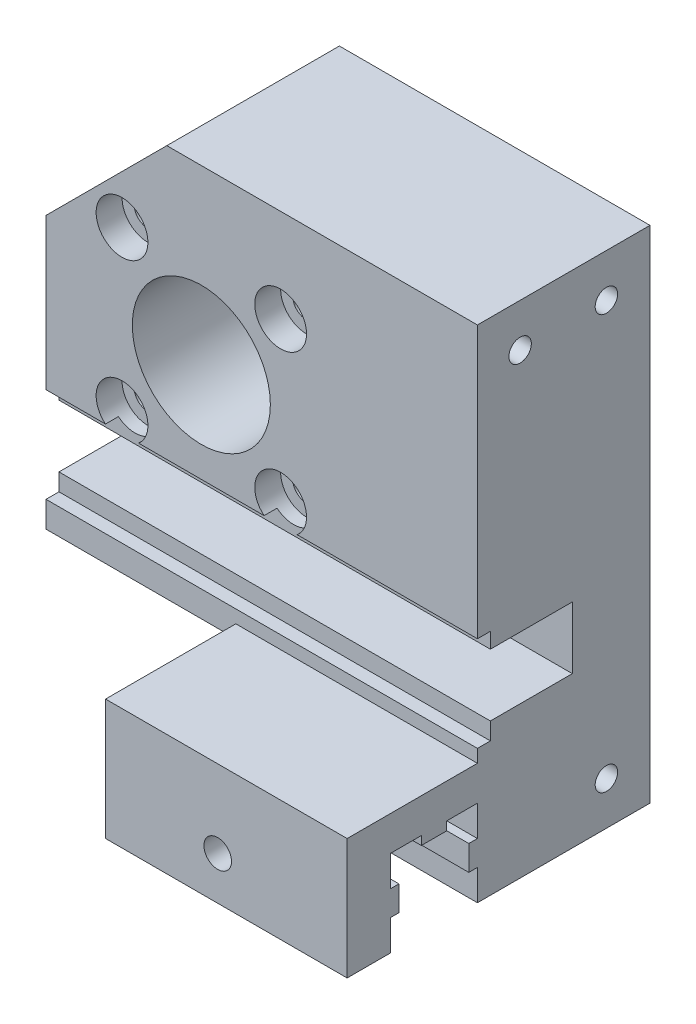
from build123d import *

# Parameters (mm, degrees)
ESQUISSE1_W                     = 50
ESQUISSE1_H                     = 45
MAIN_EXTRUSION_DEPTH            = 20
ESQUISSE5_R                     = 8
GEAR_LINEAR_HOLES_DEPTH         = 40.131189606
FIXING_EXTRUSION_DEPTH          = 25
ESQUISSE13_W                    = 50
ESQUISSE13_H                    = 7.2
ROLLINGBALLHORIZONTALHOLE_DEPTH = 11
FRONTHOLE_DEPTH                 = 22
ESQUISSE15_R                    = 1.6
BOTTOMFIXINGHOLE_DEPTH          = 56.832427853
ESQUISSE12_R                    = 16
REDUCTORMAINHOLE_DEPTH          = 5
REDUCTORFRONTFIXINGHOLE_DEPTH   = 3
ESQUISSE17_R                    = 1.6
MOTORFIXINGHOLE_DEPTH           = 53.832376437
ESQUISSE19_R                    = 3
ENL_V_MAT_EXTRU_5_DEPTH         = 3
SKETCH2_W                       = 1.5
SKETCH2_H                       = 11
CUTFORMAKERBEAMPROFILE_DEPTH    = 71.655926857
CUTFORDISTRIBUTORGRABBER_DEPTH  = 48.804288511
SKETCH4_R                       = 1.3
HOLETOBLOCKBEHIND_DEPTH         = 12


with BuildPart() as part:
    # Esquisse1 → Main Extrusion (new body)
    with BuildSketch(Plane.XY):
        Rectangle(ESQUISSE1_W, ESQUISSE1_H)
    extrude(amount=MAIN_EXTRUSION_DEPTH)

    # Esquisse5 → Gear Linear Holes (cut, through all)
    with BuildSketch(Plane.XY.offset(20)):
        with Locations((-7, 2.5)):
            Circle(ESQUISSE5_R)
    extrude(amount=-GEAR_LINEAR_HOLES_DEPTH, mode=Mode.SUBTRACT)

    # Esquisse8 → Fixing Extrusion (add, symmetric)
    with BuildSketch(Plane(origin=(0, 0, 0), x_dir=(0, 0, -1), z_dir=(1, 0, 0))):
        Polygon((-20, -25.5), (-20, -29.05), (-21, -29.05), (-21, -31.95), (-20, -31.95), (-20, -35.5), (0, -35.5), (0, -21.5), (-35.1, -21.5), (-35.1, -35.5), (-30.1, -35.5), (-30.1, -31.95), (-29.1, -31.95), (-29.1, -29.05), (-30.1, -29.05), (-30.1, -25.5), (-26.5, -25.5), (-26.5, -26.5), (-23.6, -26.5), (-23.6, -25.5), align=None)
    extrude(amount=FIXING_EXTRUSION_DEPTH, both=True)

    # Esquisse13 → RollingBallHorizontalHole (cut)
    with BuildSketch(Plane.XY.offset(20)):
        with Locations((0, -14.4)):
            Rectangle(ESQUISSE13_W, ESQUISSE13_H)
    extrude(amount=-ROLLINGBALLHORIZONTALHOLE_DEPTH, mode=Mode.SUBTRACT)

    # Esquisse14 → FrontHole (cut)
    with BuildSketch(Plane.ZY.offset(25)):
        Polygon((0, -23), (20, -23), (20, -18), (35.1, -18), (35.1, -35.5), (0, -35.5), align=None)
    extrude(amount=-FRONTHOLE_DEPTH, mode=Mode.SUBTRACT)

    # Esquisse15 → BottomFixingHole (cut, through all)
    with BuildSketch(Plane.XY.offset(35.1)):
        with Locations((10, -30.5)):
            Circle(ESQUISSE15_R)
    extrude(amount=-BOTTOMFIXINGHOLE_DEPTH, mode=Mode.SUBTRACT)

    # Esquisse12 → ReductorMainHole (cut)
    with BuildSketch(Plane.XY):
        with Locations((-7, 2.5)):
            Circle(ESQUISSE12_R)
    extrude(amount=REDUCTORMAINHOLE_DEPTH, mode=Mode.SUBTRACT)

    # Esquisse16 → ReductorFrontFixingHole (cut)
    with BuildSketch(Plane(origin=(0, 0, 5), x_dir=(-1, 0, 0), z_dir=(0, 0, -1))):
        with BuildLine():
            Line((2.641101056, 11.5), (11.358898944, 11.5))
            ThreePointArc((11.358898944, 11.5), (17, 2.5), (11.358898944, -6.5))
            Line((11.358898944, -6.5), (2.641101056, -6.5))
            ThreePointArc((2.641101056, -6.5), (-3, 2.5), (2.641101056, 11.5))
        make_face()
    extrude(amount=-REDUCTORFRONTFIXINGHOLE_DEPTH, mode=Mode.SUBTRACT)

    # Esquisse17 → MotorFixingHole (cut, through all)
    with BuildSketch(Plane(origin=(0, 0, 5), x_dir=(-1, 0, 0), z_dir=(0, 0, -1))):
        with Locations((-2.192388155, 11.692388155)):
            Circle(ESQUISSE17_R)
        with Locations((16.192388155, 11.692388155)):
            Circle(ESQUISSE17_R)
        with Locations((-2.192388155, -6.692388155)):
            Circle(ESQUISSE17_R)
        with Locations((16.192388155, -6.692388155)):
            Circle(ESQUISSE17_R)
    extrude(amount=-MOTORFIXINGHOLE_DEPTH, mode=Mode.SUBTRACT)

    # Esquisse19 → Enlèv. mat.-Extru.5 (cut)
    with BuildSketch(Plane.XY.offset(20)):
        with Locations((-16.192388155, 11.692388155)):
            Circle(ESQUISSE19_R)
        with Locations((2.192388155, 11.692388155)):
            Circle(ESQUISSE19_R)
        with Locations((-16.192388155, -6.692388155)):
            Circle(ESQUISSE19_R)
        with Locations((2.192388155, -6.692388155)):
            Circle(ESQUISSE19_R)
    extrude(amount=-ENL_V_MAT_EXTRU_5_DEPTH, mode=Mode.SUBTRACT)

    # Sketch2 → CutForMakerBeamProfile (cut, through all)
    with BuildSketch(Plane(origin=(25, 0, 0), x_dir=(0, 0, -1), z_dir=(1, 0, 0))):
        with Locations((-19.25, -14.5)):
            Rectangle(SKETCH2_W, SKETCH2_H)
    extrude(amount=-CUTFORMAKERBEAMPROFILE_DEPTH, mode=Mode.SUBTRACT)

    # Sketch3 → CutForDistributorGrabber (cut, through all)
    with BuildSketch(Plane.XY.offset(20)):
        Polygon((-11, 22.5), (-25, 8.5), (-25, 22.5), align=None)
    extrude(amount=-CUTFORDISTRIBUTORGRABBER_DEPTH, mode=Mode.SUBTRACT)

    # Sketch4 → HoleToBlockBehind (cut)
    with BuildSketch(Plane(origin=(25, 0, 0), x_dir=(0, 0, -1), z_dir=(1, 0, 0))):
        with Locations((-5.05, -30.5)):
            Circle(SKETCH4_R)
        with Locations((-25.05, -30.5)):
            Circle(SKETCH4_R)
        with Locations((-5.05, 17.5)):
            Circle(SKETCH4_R)
        with Locations((-15.05, 17.5)):
            Circle(SKETCH4_R)
    extrude(amount=-HOLETOBLOCKBEHIND_DEPTH, mode=Mode.SUBTRACT)


solid = part.part
